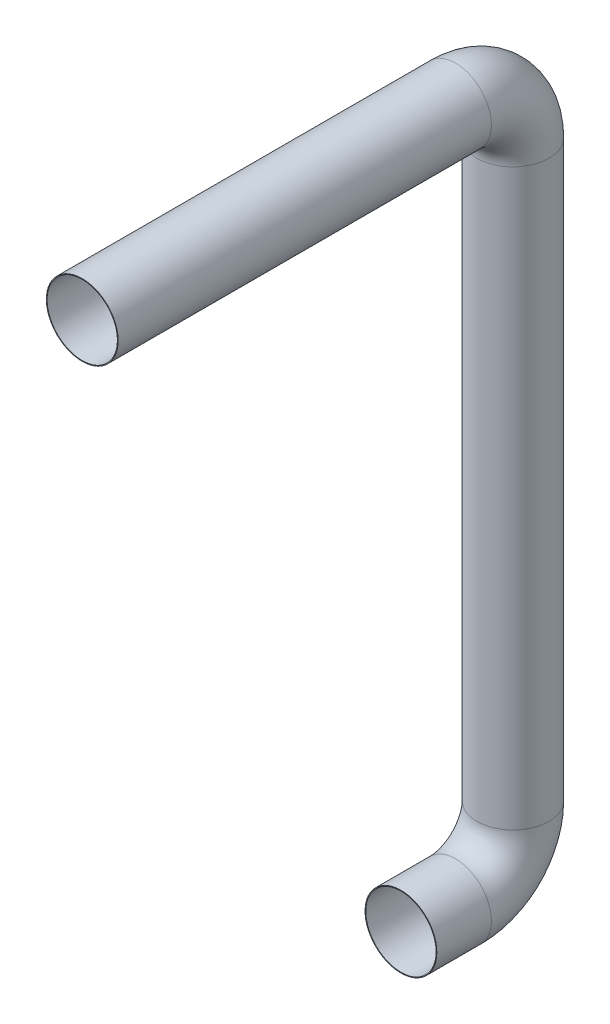
from build123d import *

# Parameters (mm, degrees)
SKETCH31_R   = 25
SKETCH31_R_2 = 24.5


with BuildPart() as part:
    # Sweep1: sweep along a path in Sketch3
    with BuildLine(Plane(origin=(0, 0, 0), x_dir=(0, 0, -1), z_dir=(1, 0, 0))) as sweep1_path:
        Line((0, 0), (260, 0))
        ThreePointArc((260, 0), (288.284271247, -11.715728753), (300, -40))
        Line((300, -40), (300, -440))
        ThreePointArc((300, -440), (288.284271247, -468.284271247), (260, -480))
        Line((260, -480), (222, -480))
    # Sketch31 → Sweep1 (sweep)
    with BuildSketch(Plane.XY):
        Circle(SKETCH31_R)
        Circle(SKETCH31_R_2, mode=Mode.SUBTRACT)
    sweep(path=sweep1_path.line)


solid = part.part
